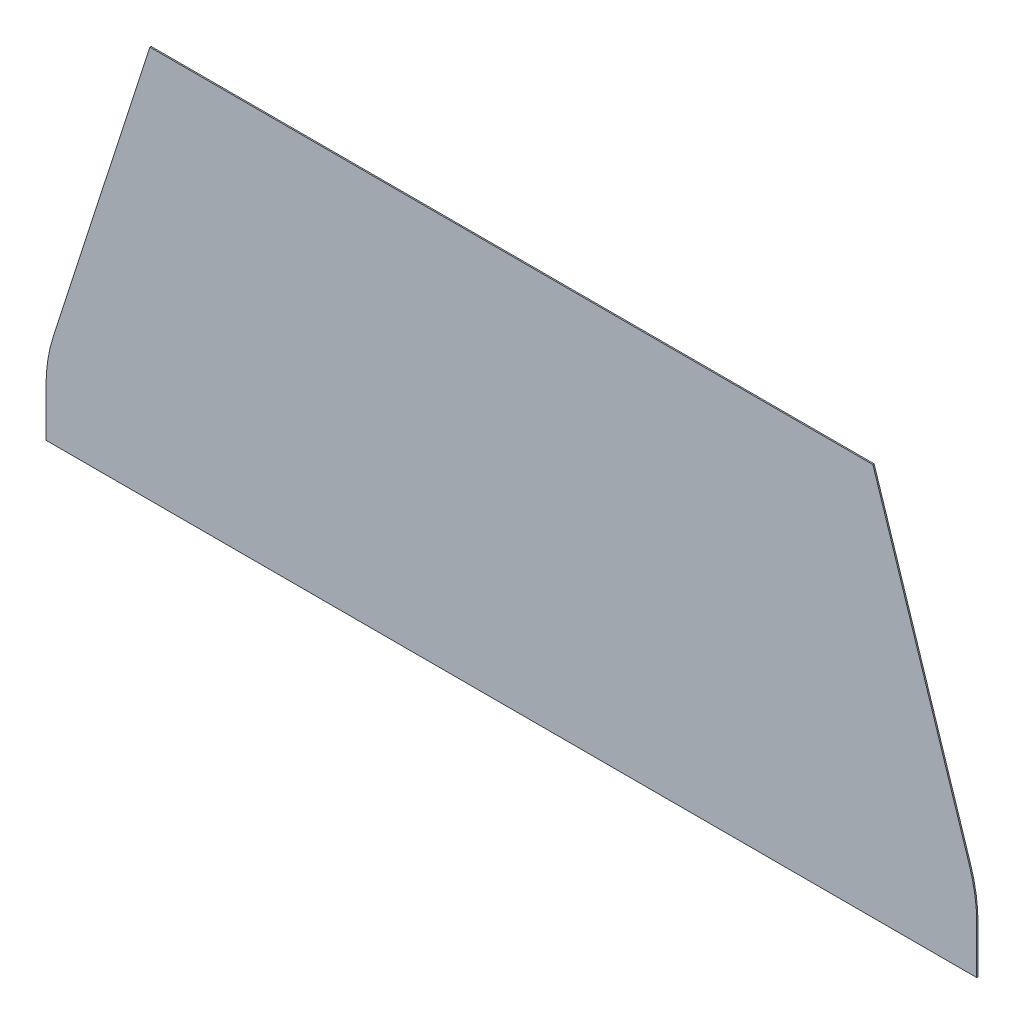
from build123d import *

# Parameters (mm, degrees)
TOP_FIREWALL_DEPTH = 1


# Sheet-metal steps are written as plain solids
with BuildPart() as part:
    # Sketch1 → Top Firewall (new body)
    with BuildSketch(Plane.XY):
        with BuildLine():
            Line((-370, 37.570353211), (-370, 0))
            Line((-370, 0), (370, 0))
            Line((370, 0), (370, 37.570353211))
            ThreePointArc((370, 37.570353211), (368.537307916, 56.249395802), (364.184889464, 74.473076931))
            Line((364.184889464, 74.473076931), (287.42, 312))
            Line((287.42, 312), (-287.42, 312))
            Line((-287.42, 312), (-364.184889464, 74.473076931))
            ThreePointArc((-364.184889464, 74.473076931), (-368.537307916, 56.249395802), (-370, 37.570353211))
        make_face()
    extrude(amount=-TOP_FIREWALL_DEPTH)


solid = part.part
